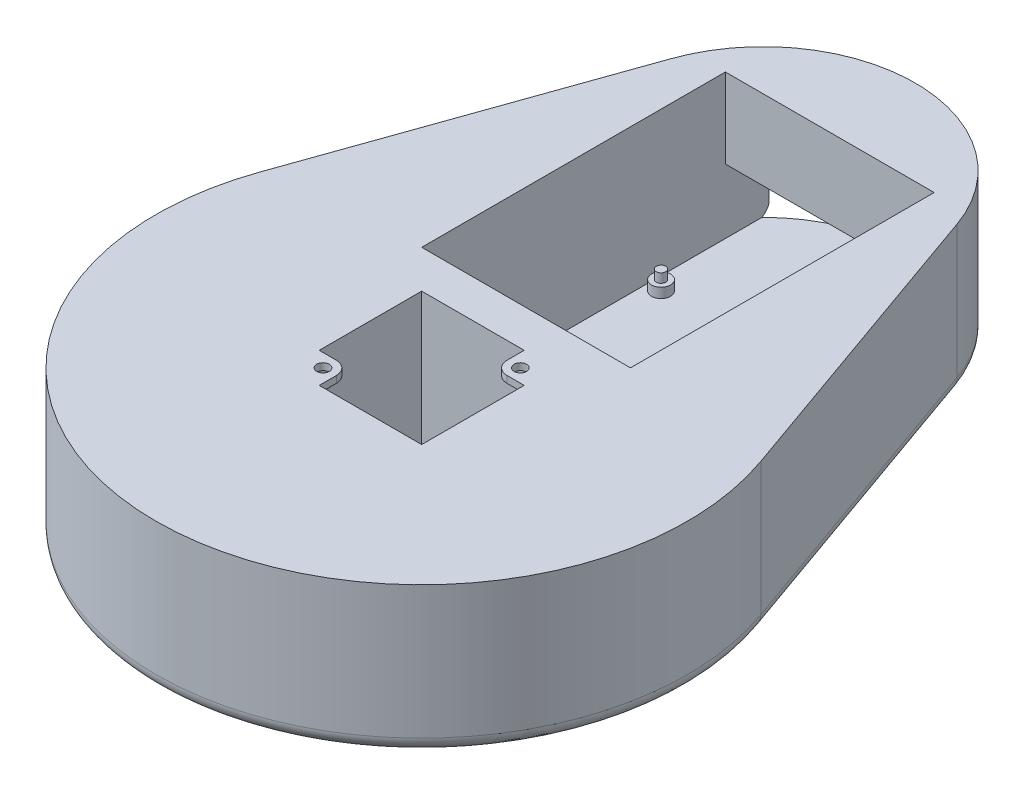
from build123d import *
from build123d.topology import SkipClean

# Parameters (mm, degrees)
ESQUISSE2_W             = 35
ESQUISSE2_H             = 35
ESQUISSE2_W_2           = 55
ESQUISSE2_H_2           = 80
BOSS_EXTRU_1_DEPTH      = 38
BOSS_EXTRU_2_START      = -1
BOSS_EXTRU_2_DEPTH      = 1
CONG_2_R                = 4
ESQUISSE3_W             = 55
ESQUISSE3_H             = 17
ENL_V_MAT_EXTRU_1_DEPTH = 195.551407124
ESQUISSE4_W             = 10
ESQUISSE4_H             = 13
ENL_V_MAT_EXTRU_2_DEPTH = 138.841394442
ESQUISSE5_R             = 1.65
BOSS_EXTRU_3_DEPTH      = 1.8
ESQUISSE6_R             = 2.5
BOSS_EXTRU_4_DEPTH      = 2.6
ESQUISSE6_3_R           = 1.25
BOSS_EXTRU_5_DEPTH      = 5


with BuildPart() as part:
    # Esquisse2 → Boss.-Extru.1 (new body)
    with BuildSketch(Plane(origin=(0, 0, 0), x_dir=(1, 0, 0), z_dir=(0, 1, 0))):
        with BuildLine():
            Line((-65.996632911, 23.333333333), (-37.712361663, 103.333333333))
            ThreePointArc((-37.712361663, 103.333333333), (0, 130), (37.712361663, 103.333333333))
            Line((37.712361663, 103.333333333), (65.996632911, 23.333333333))
            ThreePointArc((65.996632911, 23.333333333), (0, -70), (-65.996632911, 23.333333333))
        make_face()
        Rectangle(ESQUISSE2_W, ESQUISSE2_H, mode=Mode.SUBTRACT)
        with Locations((0, 67.5)):
            Rectangle(ESQUISSE2_W_2, ESQUISSE2_H_2, mode=Mode.SUBTRACT)
    extrude(amount=BOSS_EXTRU_1_DEPTH)

    # Esquisse2<2> → Boss.-Extru.2 (add)
    with SkipClean():  # the faces are left unmerged after this step: merging them gives an invalid solid
        with BuildSketch(Plane(origin=(0, 0, 0), x_dir=(1, 0, 0), z_dir=(0, 1, 0)).offset(BOSS_EXTRU_2_START)):
            with BuildLine():
                Line((-37.712361663, 103.333333333), (-65.996632911, 23.333333333))
                ThreePointArc((-65.996632911, 23.333333333), (0, -70), (65.996632911, 23.333333333))
                Line((65.996632911, 23.333333333), (37.712361663, 103.333333333))
                ThreePointArc((37.712361663, 103.333333333), (0, 130), (-37.712361663, 103.333333333))
            make_face()
        extrude(amount=BOSS_EXTRU_2_DEPTH)

    # Congé2
    # the kernel refuses this fillet: 4 mm, written as the material it takes off along each edge
    with BuildSketch(Plane(origin=(0, -1, 0), x_dir=(-0.9428090415820636, 0, -0.33333333333333304), z_dir=(0.33333333333333304, 0, -0.9428090415820636))) as cong_2_piece_1:
        with BuildLine():
            CenterArc((70 - CONG_2_R, CONG_2_R), CONG_2_R, 270, 90)
            Line((70 - CONG_2_R, 0), (70, 0))
            Line((70, 0), (70, CONG_2_R))
        make_face()
    revolve(axis=Axis((0, -1, 0), (0, 1, 0)), revolution_arc=218.942441269, mode=Mode.SUBTRACT)
    with BuildSketch(Plane(origin=(65.996632911, -1, -23.333333333), x_dir=(-0.9428090415820634, 0, 0.33333333333333354), z_dir=(-0.33333333333333354, 0, -0.9428090415820634))) as cong_2_piece_2:
        with BuildLine():
            CenterArc((CONG_2_R, CONG_2_R), CONG_2_R, 180, 90)
            Line((0, CONG_2_R), (0, 0))
            Line((0, 0), (CONG_2_R, 0))
        make_face()
    extrude(amount=84.852813742, mode=Mode.SUBTRACT)
    with BuildSketch(Plane(origin=(-37.712361663, -1, -103.333333333), x_dir=(0, 1, 0), z_dir=(-0.3333333333333333, 0, 0.9428090415820635))) as cong_2_piece_3:
        with BuildLine():
            CenterArc((CONG_2_R, -CONG_2_R), CONG_2_R, 90, 90)
            Line((0, -CONG_2_R), (0, 0))
            Line((0, 0), (CONG_2_R, 0))
        make_face()
    extrude(amount=84.852813742, mode=Mode.SUBTRACT)
    with BuildSketch(Plane(origin=(0, -1, -90), x_dir=(0.9428090415820632, 0, -0.3333333333333337), z_dir=(0.3333333333333337, 0, 0.9428090415820632))) as cong_2_piece_4:
        with BuildLine():
            CenterArc((40 - CONG_2_R, CONG_2_R), CONG_2_R, 270, 90)
            Line((40 - CONG_2_R, 0), (40, 0))
            Line((40, 0), (40, CONG_2_R))
        make_face()
    revolve(axis=Axis((0, -1, -90), (0, 1, 0)), revolution_arc=141.057558731, mode=Mode.SUBTRACT)

    # Esquisse3 → Enlèv. mat.-Extru.1 (cut, through all)
    with BuildSketch(Plane.XY.offset(-107.5)):
        with Locations((0, 8.5)):
            Rectangle(ESQUISSE3_W, ESQUISSE3_H)
    extrude(amount=-ENL_V_MAT_EXTRU_1_DEPTH, mode=Mode.SUBTRACT)

    # Esquisse4 → Enlèv. mat.-Extru.2 (cut, through all)
    with BuildSketch(Plane.XY.offset(-17.5)):
        with Locations((0, 6.5)):
            Rectangle(ESQUISSE4_W, ESQUISSE4_H)
    extrude(amount=-ENL_V_MAT_EXTRU_2_DEPTH, mode=Mode.SUBTRACT)

    # Esquisse5 → Boss.-Extru.3 (add)
    # profile 1 of 2: a face of its own
    with BuildSketch(Plane(origin=(0, 38, 0), x_dir=(1, 0, 0), z_dir=(0, 1, 0))):
        with BuildLine():
            Line((-9.5, -17.5), (-9.5, -13))
            ThreePointArc((-9.5, -13), (-10.525126266, -10.525126266), (-13, -9.5))
            Line((-13, -9.5), (-17.5, -9.5))
            Line((-17.5, -9.5), (-17.5, -17.5))
            Line((-17.5, -17.5), (-9.5, -17.5))
        make_face()
        with Locations(Location((-13, -13, 0), (0, 0, 270))):
            Circle(ESQUISSE5_R, mode=Mode.SUBTRACT)
    # profile 2 of 2: a face of its own
    with BuildSketch(Plane(origin=(0, 38, 0), x_dir=(1, 0, 0), z_dir=(0, 1, 0))):
        with BuildLine():
            Line((13, 9.5), (17.5, 9.5))
            Line((17.5, 9.5), (17.5, 17.5))
            Line((17.5, 17.5), (9.5, 17.5))
            Line((9.5, 17.5), (9.5, 13))
            ThreePointArc((9.5, 13), (10.525126266, 10.525126266), (13, 9.5))
        make_face()
        with Locations(Location((13, 13, 0), (0, 0, 270))):
            Circle(ESQUISSE5_R, mode=Mode.SUBTRACT)
    extrude(amount=-BOSS_EXTRU_3_DEPTH)

    # Esquisse6 → Boss.-Extru.4 (add)
    with BuildSketch(Plane(origin=(0, 0, 0), x_dir=(1, 0, 0), z_dir=(0, 1, 0))):
        with Locations(Location((-24.0300102, 87.0767006, 0), (0, 0, 90))):
            Circle(ESQUISSE6_R)
    extrude(amount=BOSS_EXTRU_4_DEPTH)

    # Esquisse6<3> → Boss.-Extru.5 (add)
    with BuildSketch(Plane(origin=(0, 0, 0), x_dir=(1, 0, 0), z_dir=(0, 1, 0))):
        with Locations(Location((-18.9500102, 35.0067006, 0), (0, 0, 270))):
            Circle(ESQUISSE6_3_R)
        with Locations(Location((8.9899898, 35.0067006, 0), (0, 0, 270))):
            Circle(ESQUISSE6_3_R)
        with Locations(Location((24.2299898, 85.8067006, 0), (0, 0, 270))):
            Circle(ESQUISSE6_3_R)
        with Locations(Location((-24.0300102, 87.0767006, 0), (0, 0, 270))):
            Circle(ESQUISSE6_3_R)
    extrude(amount=BOSS_EXTRU_5_DEPTH)


solid = part.part
